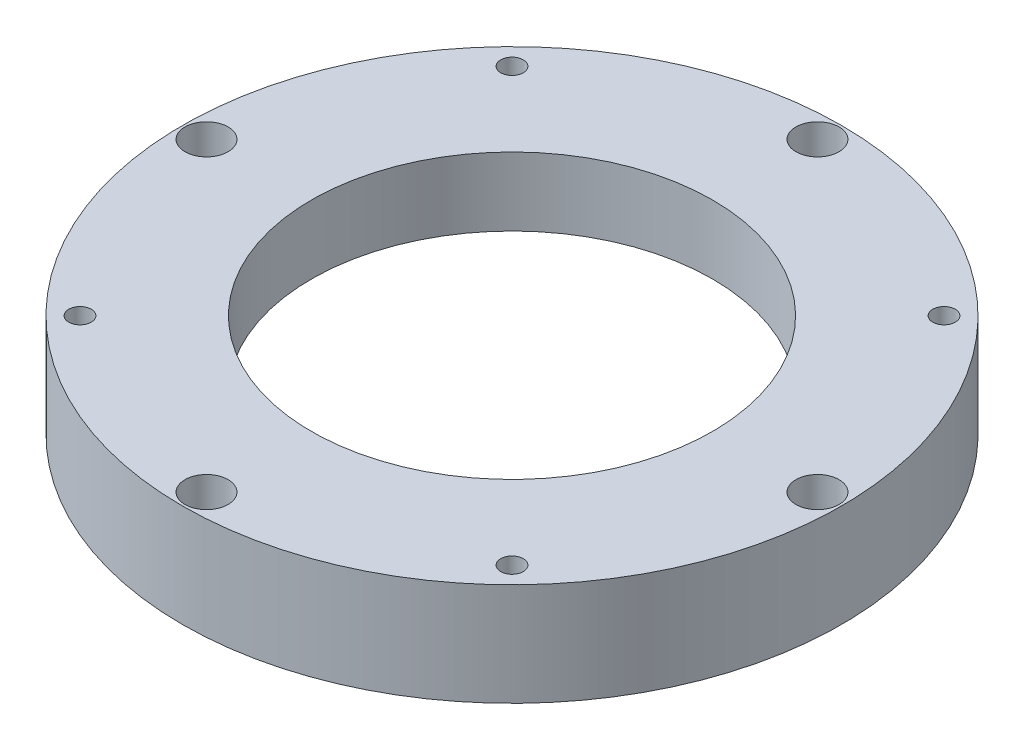
from build123d import *

# Parameters (mm, degrees)
SKETCH1_R           = 45.85
SKETCH1_R_2         = 1.5635
SKETCH1_R_3         = 40.5
BOSS_EXTRUDE1_DEPTH = 4.7625
BOSS_EXTRUDE2_START = 4.7625
SKETCH1_4_R         = 45.85
SKETCH1_4_R_2       = 1.5635
SKETCH1_4_R_3       = 27.9
BOSS_EXTRUDE2_DEPTH = 4.7625
CUT_EXTRUDE2_DEPTH  = 4.7625
BOSS_EXTRUDE3_START = 4.7625
SKETCH3_R           = 45.85
SKETCH3_R_2         = 3
SKETCH3_R_3         = 27.9
SKETCH3_R_4         = 1.565
BOSS_EXTRUDE3_DEPTH = 4.7625


with BuildPart() as part:
    # Sketch1 → Boss-Extrude1 (new body)
    with BuildSketch(Plane(origin=(0, 0, 0), x_dir=(1, 0, 0), z_dir=(0, 1, 0))):
        Circle(SKETCH1_R)
        with Locations((-30.0520382, -30.0520382)):
            Circle(SKETCH1_R_2, mode=Mode.SUBTRACT)
        with Locations((0, -42.5)):
            Circle(SKETCH1_R_2, mode=Mode.SUBTRACT)
        with Locations((30.0520382, -30.0520382)):
            Circle(SKETCH1_R_2, mode=Mode.SUBTRACT)
        with Locations((-42.5, 0)):
            Circle(SKETCH1_R_2, mode=Mode.SUBTRACT)
        with Locations((-30.0520382, 30.0520382)):
            Circle(SKETCH1_R_2, mode=Mode.SUBTRACT)
        Circle(SKETCH1_R_3, mode=Mode.SUBTRACT)
        with Locations((42.5, 0)):
            Circle(SKETCH1_R_2, mode=Mode.SUBTRACT)
        with Locations((0, 42.5)):
            Circle(SKETCH1_R_2, mode=Mode.SUBTRACT)
        with Locations((30.0520382, 30.0520382)):
            Circle(SKETCH1_R_2, mode=Mode.SUBTRACT)
    extrude(amount=-BOSS_EXTRUDE1_DEPTH)

    # Sketch1<4> → Boss-Extrude2 (add)
    with BuildSketch(Plane(origin=(0, 0, 0), x_dir=(1, 0, 0), z_dir=(0, 1, 0)).offset(BOSS_EXTRUDE2_START)):
        Circle(SKETCH1_4_R)
        with Locations((-30.0520382, -30.0520382)):
            Circle(SKETCH1_4_R_2, mode=Mode.SUBTRACT)
        with Locations((0, -42.5)):
            Circle(SKETCH1_4_R_2, mode=Mode.SUBTRACT)
        with Locations((30.0520382, -30.0520382)):
            Circle(SKETCH1_4_R_2, mode=Mode.SUBTRACT)
        with Locations((-42.5, 0)):
            Circle(SKETCH1_4_R_2, mode=Mode.SUBTRACT)
        with Locations((-30.0520382, 30.0520382)):
            Circle(SKETCH1_4_R_2, mode=Mode.SUBTRACT)
        with Locations((42.5, 0)):
            Circle(SKETCH1_4_R_2, mode=Mode.SUBTRACT)
        with Locations((0, 42.5)):
            Circle(SKETCH1_4_R_2, mode=Mode.SUBTRACT)
        with Locations((30.0520382, 30.0520382)):
            Circle(SKETCH1_4_R_2, mode=Mode.SUBTRACT)
        Circle(SKETCH1_4_R_3, mode=Mode.SUBTRACT)
    extrude(amount=-BOSS_EXTRUDE2_DEPTH)

    # Sketch4 → Cut-Extrude2 (cut)
    with BuildSketch(Plane(origin=(0, 4.7625, 0), x_dir=(1, 0, 0), z_dir=(0, 1, 0))):
        Polygon((28.493192474, -27.3520382), (26.934346747, -30.0520382), (28.493192474, -32.7520382), (31.610883927, -32.7520382), (33.169729654, -30.0520382), (31.610883927, -27.3520382), align=None)
        Polygon((30.0520382, 33.169729654), (27.3520382, 31.610883927), (27.3520382, 28.493192474), (30.0520382, 26.934346747), (32.7520382, 28.493192474), (32.7520382, 31.610883927), align=None)
        Polygon((-27.3520382, -28.493192474), (-30.0520382, -26.934346747), (-32.7520382, -28.493192474), (-32.7520382, -31.610883927), (-30.0520382, -33.169729654), (-27.3520382, -31.610883927), align=None)
        Polygon((-28.493192474, 27.3520382), (-26.934346747, 30.0520382), (-28.493192474, 32.7520382), (-31.610883927, 32.7520382), (-33.169729654, 30.0520382), (-31.610883927, 27.3520382), align=None)
    extrude(amount=-CUT_EXTRUDE2_DEPTH, mode=Mode.SUBTRACT)

    # Sketch3 → Boss-Extrude3 (add)
    with BuildSketch(Plane(origin=(0, 4.7625, 0), x_dir=(1, 0, 0), z_dir=(0, 1, 0)).offset(BOSS_EXTRUDE3_START)):
        Circle(SKETCH3_R)
        with Locations((0, -42.5)):
            Circle(SKETCH3_R_2, mode=Mode.SUBTRACT)
        with Locations((-42.5, 0)):
            Circle(SKETCH3_R_2, mode=Mode.SUBTRACT)
        Circle(SKETCH3_R_3, mode=Mode.SUBTRACT)
        with Locations((42.5, 0)):
            Circle(SKETCH3_R_2, mode=Mode.SUBTRACT)
        with Locations((0, 42.5)):
            Circle(SKETCH3_R_2, mode=Mode.SUBTRACT)
        with Locations((-30.0520382, -30.0520382)):
            Circle(SKETCH3_R_4, mode=Mode.SUBTRACT)
        with Locations((30.0520382, -30.0520382)):
            Circle(SKETCH3_R_4, mode=Mode.SUBTRACT)
        with Locations((-30.0520382, 30.0520382)):
            Circle(SKETCH3_R_4, mode=Mode.SUBTRACT)
        with Locations((30.0520382, 30.0520382)):
            Circle(SKETCH3_R_4, mode=Mode.SUBTRACT)
    extrude(amount=-BOSS_EXTRUDE3_DEPTH)


solid = part.part
